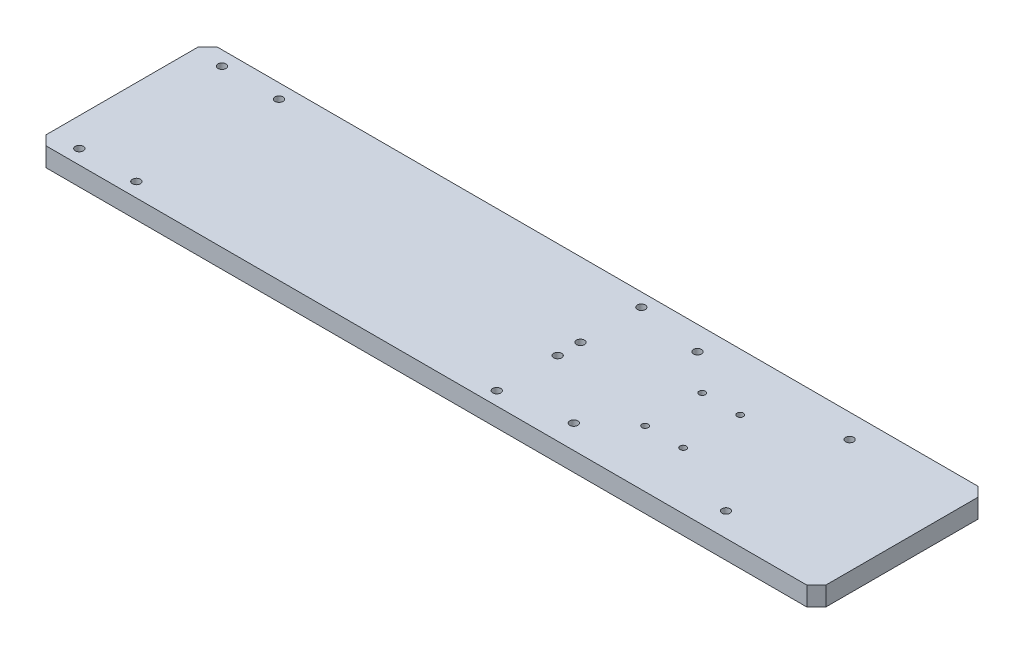
from build123d import *

# Parameters (mm, degrees)
CROQUIS1_W              = 410
CROQUIS1_H              = 90
SALIENTE_EXTRUIR1_DEPTH = 10
CHAFL_N1_SIZE           = 5
TALADRO_ROSCADO_M53_D   = 4.2
TALADRO_ROSCADO_M51_D   = 4.2
TALADRO_ROSCADO_M41_D   = 3.3
TALADRO_ROSCADO_M52_D   = 4.2


with BuildPart() as part:
    # Croquis1 → Saliente-Extruir1 (new body)
    with BuildSketch(Plane(origin=(0, 0, 0), x_dir=(1, 0, 0), z_dir=(0, 1, 0))):
        with Locations((205, 0)):
            Rectangle(CROQUIS1_W, CROQUIS1_H)
    extrude(amount=SALIENTE_EXTRUIR1_DEPTH)

    # Chaflán1
    chafl_n1_edges = [part.edges().sort_by_distance(p)[0] for p in [
        (0, 5, -45),
        (0, 5, 45),
        (410, 5, 45),
        (410, 5, -45),
    ]]
    chamfer(chafl_n1_edges, length=CHAFL_N1_SIZE)

    # Taladro roscado M53 (through all)
    with Locations(Plane(origin=(0, 0, 0), x_dir=(-1, 0, 0), z_dir=(0, -1, 0))):
        with Locations((-15, -37.5), (-45, 37.5), (-45, -37.5), (-15, 37.5)):
            Hole(TALADRO_ROSCADO_M53_D / 2)

    # Taladro roscado M51 (through all)
    with Locations(Plane(origin=(0, 0, 0), x_dir=(-1, 0, 0), z_dir=(0, -1, 0))):
        with Locations((-235, 38), (-235, 6), (-235, -6), (-235, -38)):
            Hole(TALADRO_ROSCADO_M51_D / 2)

    # Taladro roscado M41 (through all)
    with Locations(Plane(origin=(0, 0, 0), x_dir=(-1, 0, 0), z_dir=(0, -1, 0))):
        with Locations((-290, 15), (-310, -15), (-310, 15), (-290, -15)):
            Hole(TALADRO_ROSCADO_M41_D / 2)

    # Taladro roscado M52 (through all)
    with Locations(Plane(origin=(0, 0, 0), x_dir=(-1, 0, 0), z_dir=(0, -1, 0))):
        with Locations((-270, 32.5), (-350, -32.5), (-350, 32.5), (-270, -32.5)):
            Hole(TALADRO_ROSCADO_M52_D / 2)


solid = part.part
